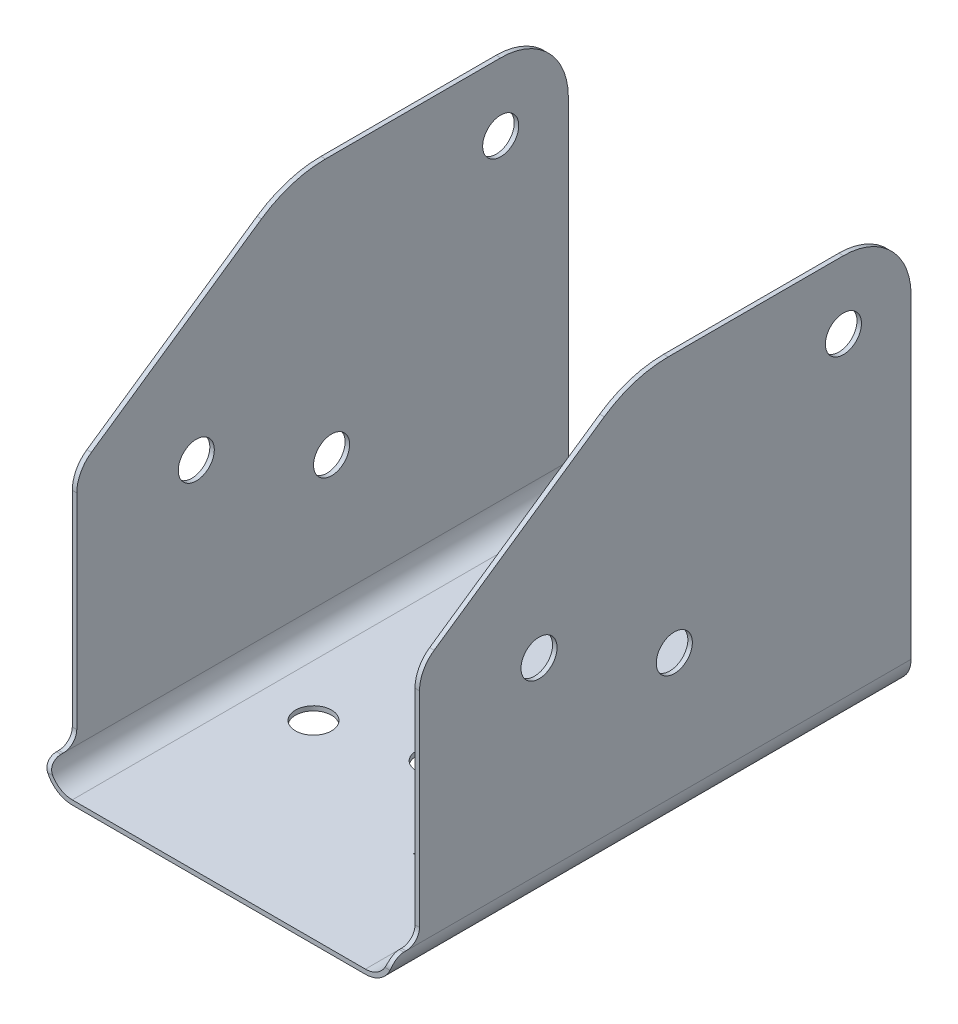
from build123d import *

# Parameters (mm, degrees)
SKETCH1_W                      = 150
SKETCH1_H                      = 230
BASE_FLANGE1_DEPTH             = 2
EDGE_FLANGE1_STRIP_W           = 28
EDGE_FLANGE1_STRIP_H           = 2
EDGE_FLANGE1_STRIP_CUT_DEPTH   = 230
EDGE_FLANGE1_STRIP_2_W         = 28
EDGE_FLANGE1_STRIP_2_H         = 2
EDGE_FLANGE1_STRIP_CUT_2_DEPTH = 230
EDGE_FLANGE1_DEPTH             = 230
EDGE_FLANGE1_BEND_DEPTH        = 230
SKETCH15_OUTSIDE_W             = 298.254
SKETCH15_OUTSIDE_H             = 250.254
SKETCH15_OUTSIDE_R             = 8
CUT_EXTRUDE1_DEPTH             = 264.326793168
SKETCH16_R                     = 8
CUT_EXTRUDE2_DEPTH             = 228.055059487
CUT_EXTRUDE3_DEPTH             = 228.055059487
SKETCHED_START                 = 47
SKETCHED_BEND1_DEPTH           = 11.052994728
SKETCHED_BEND1_2_DEPTH         = 11.052994728
CUT_EXTRUDE4_REACH             = 241.866
SKETCH20_R                     = 1.25


# Read off the part's stored shape, not the designer's step: Sketched Bend1
# Sheet-metal steps are written as plain solids
with BuildPart() as part:
    # Sketch1 → Base-Flange1 (new body)
    with BuildSketch(Plane(origin=(0, 0, 0), x_dir=(1, 0, 0), z_dir=(0, 1, 0))):
        Rectangle(SKETCH1_W, SKETCH1_H)
    extrude(amount=-BASE_FLANGE1_DEPTH)

    # Edge-Flange1 strip (across the edge) → Edge-Flange1 strip cut (cut)
    with BuildSketch(Plane(origin=(75, 0, 115), x_dir=(-1, 0, 0), z_dir=(0, 0, -1))):
        with Locations((-4, -1)):
            Rectangle(EDGE_FLANGE1_STRIP_W, EDGE_FLANGE1_STRIP_H)
    extrude(amount=EDGE_FLANGE1_STRIP_CUT_DEPTH, mode=Mode.SUBTRACT)

    # Edge-Flange1 strip 2 (across the edge) → Edge-Flange1 strip cut 2 (cut)
    with BuildSketch(Plane(origin=(-75, 0, -115), x_dir=(1, 0, 0), z_dir=(0, 0, 1))):
        with Locations((-4, -1)):
            Rectangle(EDGE_FLANGE1_STRIP_2_W, EDGE_FLANGE1_STRIP_2_H)
    extrude(amount=EDGE_FLANGE1_STRIP_CUT_2_DEPTH, mode=Mode.SUBTRACT)

    # Edge-Flange1 section (across the edge) → Edge-Flange1 (add)
    with BuildSketch(Plane(origin=(75, 0, 115), x_dir=(-1, 0, 0), z_dir=(0, 0, -1))):
        with BuildLine():
            Line((-2, 10), (-2, 180))
            Line((-2, 180), (0, 180))
            Line((0, 180), (0, 10))
            ThreePointArc((0, 10), (2.928932188, 2.928932188), (10, 0))
            Line((10, 0), (10, -2))
            ThreePointArc((10, -2), (1.514718626, 1.514718626), (-2, 10))
        make_face()
    extrude(amount=EDGE_FLANGE1_DEPTH)

    # Edge-Flange1 section 2 (across the edge) → Edge-Flange1 bend (add)
    with BuildSketch(Plane(origin=(-75, 0, -115), x_dir=(1, 0, 0), z_dir=(0, 0, 1))):
        with BuildLine():
            Line((-2, 10), (-2, 180))
            Line((-2, 180), (0, 180))
            Line((0, 180), (0, 10))
            ThreePointArc((0, 10), (2.928932188, 2.928932188), (10, 0))
            Line((10, 0), (10, -2))
            ThreePointArc((10, -2), (1.514718626, 1.514718626), (-2, 10))
        make_face()
    extrude(amount=EDGE_FLANGE1_BEND_DEPTH)

    # Sketch15 outside → Cut-Extrude1 (cut, through all)
    # profile 1 of 4: a face of its own
    with BuildSketch(Plane.ZY.offset(77)):
        with Locations((0, 89)):
            Rectangle(SKETCH15_OUTSIDE_W, SKETCH15_OUTSIDE_H)
        with BuildLine():
            Line((21.083470393, 171.180744276), (96.507242037, 119.243178795))
            ThreePointArc((96.507242037, 119.243178795), (101.277963521, 113.867184852), (103, 106.888955512))
            Line((103, 106.888955512), (103, 16))
            ThreePointArc((103, 16), (104.757359313, 11.757359313), (109, 10))
            Line((109, 10), (110, 10))
            ThreePointArc((110, 10), (113.535533906, 8.535533906), (115, 5))
            Line((115, 5), (115, -2))
            Line((115, -2), (-115, -2))
            Line((-115, -2), (-115, 99))
            Line((-115, 99), (-115, 150))
            ThreePointArc((-115, 150), (-106.213203436, 171.213203436), (-85, 180))
            Line((-85, 180), (-7.274003064, 180))
            ThreePointArc((-7.274003064, 180), (7.574612801, 177.744304445), (21.083470393, 171.180744276))
        make_face(mode=Mode.SUBTRACT)
    # profile 2 of 4: a face of its own
    with BuildSketch(Plane.ZY.offset(77)):
        with Locations(Location((50, 93, 0), (0, 0, 270))):
            Circle(SKETCH15_OUTSIDE_R)
    # profile 3 of 4: a face of its own
    with BuildSketch(Plane.ZY.offset(77)):
        with Locations(Location((-85, 150, 0), (0, 0, 270))):
            Circle(SKETCH15_OUTSIDE_R)
    # profile 4 of 4: a face of its own
    with BuildSketch(Plane.ZY.offset(77)):
        with Locations(Location((-10, 65, 0), (0, 0, 270))):
            Circle(SKETCH15_OUTSIDE_R)
    extrude(amount=-CUT_EXTRUDE1_DEPTH, mode=Mode.SUBTRACT)

    # Sketch16 → Cut-Extrude2 (cut, through all)
    with BuildSketch(Plane(origin=(0, 0, 0), x_dir=(1, 0, 0), z_dir=(0, 1, 0))):
        with Locations(Location((-42, 39, 0), (0, 0, 270))):
            Circle(SKETCH16_R)
        with Locations(Location((42, 39, 0), (0, 0, 90))):
            Circle(SKETCH16_R)
        with Locations(Location((-42, -31, 0), (0, 0, 90))):
            Circle(SKETCH16_R)
        with Locations(Location((42, -31, 0), (0, 0, 270))):
            Circle(SKETCH16_R)
        with BuildLine():
            Line((7.5, 20), (7.5, -20))
            ThreePointArc((7.5, -20), (0, -27.5), (-7.5, -20))
            Line((-7.5, -20), (-7.5, 20))
            ThreePointArc((-7.5, 20), (0, 27.5), (7.5, 20))
        make_face()
    extrude(amount=-CUT_EXTRUDE2_DEPTH, mode=Mode.SUBTRACT)

    # Sketch18 → Cut-Extrude3 (cut, through all)
    with BuildSketch(Plane(origin=(0, 0, 0), x_dir=(1, 0, 0), z_dir=(0, 1, 0))):
        Polygon((31.4, -45), (44.4, -45), (44.4, -60.052994728), (31.4, -60.052994728), (31.4, -58.052994728), (42.4, -58.052994728), (42.4, -47), (31.4, -47), align=None)
    extrude(amount=-CUT_EXTRUDE3_DEPTH, mode=Mode.SUBTRACT)

    # Sketched Bend1 outline → Sketched Bend1 (cut)
    with BuildSketch(Plane.XY.offset(SKETCHED_START)):
        with BuildLine():
            ThreePointArc((34.035602398, 0), (33.054267209, -1.443395312), (31.4, -2))
            Line((31.4, -2), (42.4, -2))
            Line((42.4, -2), (42.4, 0))
            Line((42.4, 0), (34.035602398, 0))
        make_face()
    extrude(amount=SKETCHED_BEND1_DEPTH, mode=Mode.SUBTRACT)

    # Sketched Bend1 2 outline → Sketched Bend1 2 (add)
    with BuildSketch(Plane.XY.offset(SKETCHED_START)):
        with BuildLine():
            Line((31.4, 0), (34.035602398, 0))
            ThreePointArc((34.035602398, 0), (34.111233029, 0.364854094), (34.1366, 0.7366))
            Line((34.1366, 0.7366), (34.1366, 9.008755099))
            Line((34.1366, 9.008755099), (32.1366, 9.008755099))
            Line((32.1366, 9.008755099), (32.1366, 0.7366))
            ThreePointArc((32.1366, 0.7366), (31.920854855, 0.215745145), (31.4, 0))
        make_face()
    extrude(amount=SKETCHED_BEND1_2_DEPTH)

    # Sketch20 → Cut-Extrude4 (cut, up to next)
    with BuildSketch(Plane.ZY.offset(-32.1366), mode=Mode.PRIVATE) as cut_extrude4_sk1:
        with Locations(Location((52.526497364, 4.9366, 0), (0, 0, 270))):
            Circle(SKETCH20_R)
    cut_extrude4_tool1 = extrude(cut_extrude4_sk1.sketch, amount=-CUT_EXTRUDE4_REACH, mode=Mode.PRIVATE) & part.part
    add(cut_extrude4_tool1.solids().sort_by_distance((32.1366, 4.9366, 52.526497))[0], mode=Mode.SUBTRACT)


solid = part.part
